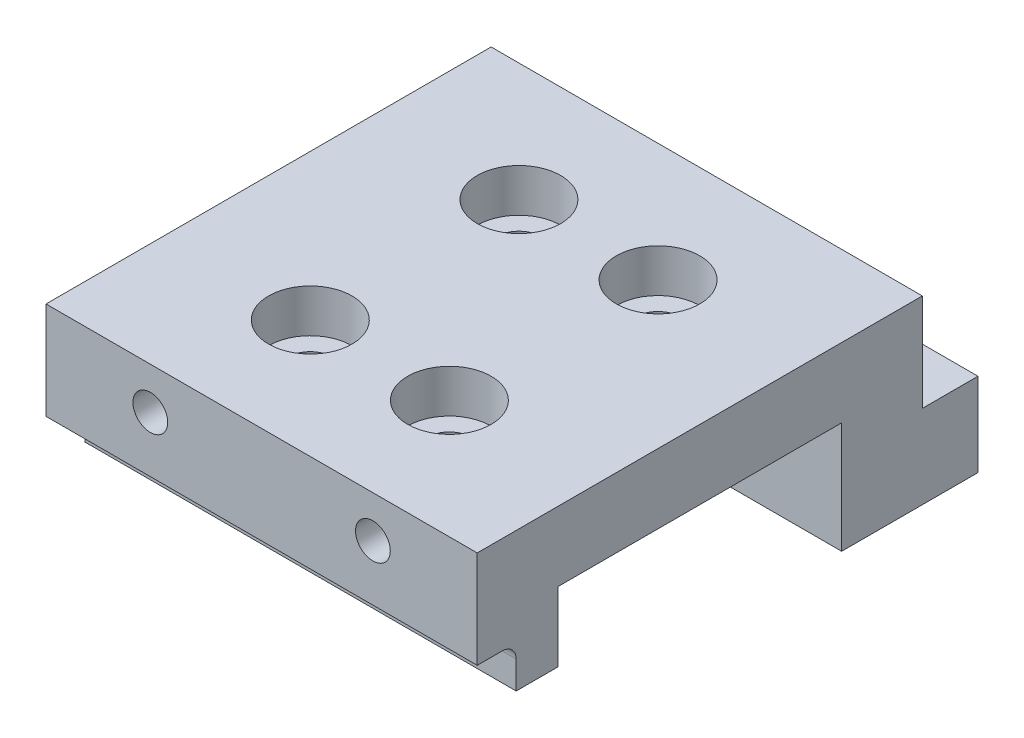
from build123d import *

# Parameters (mm, degrees)
SKETCH_1_W                     = 31
SKETCH_1_H                     = 40
SKETCH_1_R                     = 1.6
EXTRUDE_1_DEPTH                = 5
SKETCH_2_W                     = 31
SKETCH_2_H                     = 9.8
EXTRUDE_3_DEPTH                = 8
SKETCH_13_R                    = 1
CUT_EXTRUDE_7_DEPTH            = 5
EXTRUDE_START                  = 1
SKETCH_14_R                    = 3
SKETCH_14_R_2                  = 1
EXTRUDE_8_DEPTH                = 1
HOLE_WIZARD_M3_3_D             = 2.5
HOLE_WIZARD_M3_3_DEPTH         = 6.5
HOLE_WIZARD_M3_3_TIP           = 0.751075774
SKETCH_18_W                    = 31
SKETCH_18_H                    = 3
EXTRUDE_9_DEPTH                = 10
SKETCH_29_W                    = 31
SKETCH_29_H                    = 6.8
EXTRUDE_11_DEPTH               = 2
SKETCH_20_R                    = 1
CUT_EXTRUDE_9_DEPTH            = 9
HOLE_START                     = -9
HOLE_WIZARD_M3_1_OUTLINE_R     = 1.25
HOLE_WIZARD_M3_1_OUTLINE_R_2   = 1
HOLE_WIZARD_M3_1_DEPTH         = 9
HOLE_WIZARD_M3_1_3_D           = 3.2
HOLE_WIZARD_M3_1_3_CBORE_D     = 6
HOLE_WIZARD_M3_1_3_CBORE_DEPTH = 3.1
HOLE_START_2                   = -40
HOLE_WIZARD_M3_2_OUTLINE_R     = 1.25
HOLE_WIZARD_M3_2_OUTLINE_R_2   = 1
HOLE_WIZARD_M3_2_DEPTH         = 9
FILLET_2_R                     = 1
SKETCH_30_W                    = 31
SKETCH_30_H                    = 7
CUT_EXTRUDE_10_DEPTH           = 4


# Read off the part's stored shape, not the designer's step: M3 螺纹孔1, M3 螺纹孔2
with BuildPart() as part:
    # 草图1 → 凸台-拉伸1 (new body)
    with BuildSketch(Plane(origin=(0, 0, 0), x_dir=(1, 0, 0), z_dir=(0, 1, 0))):
        with Locations((15.5, 20)):
            Rectangle(SKETCH_1_W, SKETCH_1_H)
        with Locations(Location((20.5, 27.5, 0), (0, 0, 270))):
            Circle(SKETCH_1_R, mode=Mode.SUBTRACT)
        with Locations(Location((10.5, 27.5, 0), (0, 0, 270))):
            Circle(SKETCH_1_R, mode=Mode.SUBTRACT)
        with Locations(Location((10.5, 12.5, 0), (0, 0, 90))):
            Circle(SKETCH_1_R, mode=Mode.SUBTRACT)
        with Locations(Location((20.5, 12.5, 0), (0, 0, 90))):
            Circle(SKETCH_1_R, mode=Mode.SUBTRACT)
    extrude(amount=EXTRUDE_1_DEPTH)

    # 草图2 → 凸台-拉伸3 (add)
    with BuildSketch(Plane(origin=(0, 0, 0), x_dir=(1, 0, 0), z_dir=(0, 1, 0))):
        with Locations((15.5, 35.1)):
            Rectangle(SKETCH_2_W, SKETCH_2_H)
    extrude(amount=-EXTRUDE_3_DEPTH)

    # 草图13 → 切除-拉伸7 (cut)
    with BuildSketch(Plane.XZ.offset(8)):
        with Locations(Location((15.5, -35.1, 0), (0, 0, 270))):
            Circle(SKETCH_13_R)
    extrude(amount=-CUT_EXTRUDE_7_DEPTH, mode=Mode.SUBTRACT)

    # 草图14 → 凸台-拉伸8 (add)
    with BuildSketch(Plane.XZ.offset(8).offset(EXTRUDE_START)):
        with Locations(Location((15.5, -35.1, 0), (0, 0, 270))):
            Circle(SKETCH_14_R)
        with Locations(Location((15.5, -35.1, 0), (0, 0, 270))):
            Circle(SKETCH_14_R_2, mode=Mode.SUBTRACT)
    extrude(amount=-EXTRUDE_8_DEPTH)

    # M3 螺纹孔3
    with Locations(Plane(origin=(0, -9, 0), x_dir=(-1, 0, 0), z_dir=(0, -1, 0))):
        with Locations((-15.5, 35.1)):
            Hole(HOLE_WIZARD_M3_3_D / 2, depth=HOLE_WIZARD_M3_3_DEPTH)
            with Locations((0, 0, -(HOLE_WIZARD_M3_3_DEPTH + HOLE_WIZARD_M3_3_TIP / 2))):  # 118° drill point
                Cone(0, HOLE_WIZARD_M3_3_D / 2, HOLE_WIZARD_M3_3_TIP, mode=Mode.SUBTRACT)

    # 草图18 → 凸台-拉伸9 (add)
    with BuildSketch(Plane(origin=(0, 5, 0), x_dir=(1, 0, 0), z_dir=(0, 1, 0))):
        with Locations((15.5, 8.3)):
            Rectangle(SKETCH_18_W, SKETCH_18_H)
    extrude(amount=-EXTRUDE_9_DEPTH)

    # 草图29 → 凸台-拉伸11 (add)
    with BuildSketch(Plane.XZ):
        with Locations((15.5, -3.4)):
            Rectangle(SKETCH_29_W, SKETCH_29_H)
    extrude(amount=EXTRUDE_11_DEPTH)

    # 草图20 → 切除-拉伸9 (cut)
    with BuildSketch(Plane.XY):
        with Locations((7.5, 2)):
            Circle(SKETCH_20_R)
        with Locations(Location((23.5, 2, 0), (0, 0, 180))):
            Circle(SKETCH_20_R)
    cut_extrude_9 = extrude(amount=-CUT_EXTRUDE_9_DEPTH, mode=Mode.SUBTRACT)

    # Hole Wizard M3 _1 outline → Hole Wizard M3 _1 (cut)
    with BuildSketch(Plane.XY.offset(HOLE_START)):
        with Locations((23.5, 2)):
            Circle(HOLE_WIZARD_M3_1_OUTLINE_R)
        with Locations((23.5, 2)):
            Circle(HOLE_WIZARD_M3_1_OUTLINE_R_2, mode=Mode.SUBTRACT)
    extrude(amount=HOLE_WIZARD_M3_1_DEPTH, mode=Mode.SUBTRACT)

    # Hole Wizard M3 _1 2 outline → Hole Wizard M3 _1 2 (revolve, cut)
    with BuildSketch(Plane(origin=(7.5, 2, 0), x_dir=(1, 0, 0), z_dir=(0, -1, 0))):
        Polygon((0, -9), (0, -9.751075774), (1.25, -9), (1.25, 0), (1, 0), (1, -9), align=None)
    revolve(axis=Axis((7.5, 2, 0), (0, 0, 1)), mode=Mode.SUBTRACT)

    # 镜向1: 切除-拉伸9 across plane
    add(cut_extrude_9.mirror(Plane.XY.offset(-20)), mode=Mode.SUBTRACT)

    # Hole Wizard M3 _1 3 (through all)
    with Locations(Plane(origin=(0, 5, 0), x_dir=(1, 0, 0), z_dir=(0, 1, 0))):
        with Locations((10.5, 27.5), (10.5, 12.5), (20.5, 12.5), (20.5, 27.5)):
            CounterBoreHole(HOLE_WIZARD_M3_1_3_D / 2, HOLE_WIZARD_M3_1_3_CBORE_D / 2, HOLE_WIZARD_M3_1_3_CBORE_DEPTH)

    # M3 螺纹孔2 outline → M3 螺纹孔2 (cut)
    with BuildSketch(Plane.XY.offset(HOLE_START_2)):
        with Locations((7.5, 2)):
            Circle(HOLE_WIZARD_M3_2_OUTLINE_R)
        with Locations((7.5, 2)):
            Circle(HOLE_WIZARD_M3_2_OUTLINE_R_2, mode=Mode.SUBTRACT)
    extrude(amount=HOLE_WIZARD_M3_2_DEPTH, mode=Mode.SUBTRACT)

    # Hole Wizard M3 _2 2 outline → Hole Wizard M3 _2 2 (revolve, cut)
    with BuildSketch(Plane(origin=(23.5, 2, 0), x_dir=(1, 0, 0), z_dir=(0, -1, 0))):
        Polygon((1.25, -31), (0, -30.248924226), (0, -31), (1, -31), (1, -40), (1.25, -40), align=None)
    revolve(axis=Axis((23.5, 2, 0), (0, 0, 1)), mode=Mode.SUBTRACT)

    # 圆角2
    fillet_2_edges = [part.edges().sort_by_distance(p)[0] for p in [
        (15.5, -2, -6.8),
    ]]
    fillet(fillet_2_edges, radius=FILLET_2_R)

    # 草图30 → 切除-拉伸10 (cut)
    with BuildSketch(Plane.XY):
        with Locations((15.5, 1.5)):
            Rectangle(SKETCH_30_W, SKETCH_30_H)
    cut_extrude_10 = extrude(amount=-CUT_EXTRUDE_10_DEPTH, mode=Mode.SUBTRACT)

    # 镜向3: 切除-拉伸10 across plane
    add(cut_extrude_10.mirror(Plane.XY.offset(-20)), mode=Mode.SUBTRACT)


solid = part.part
